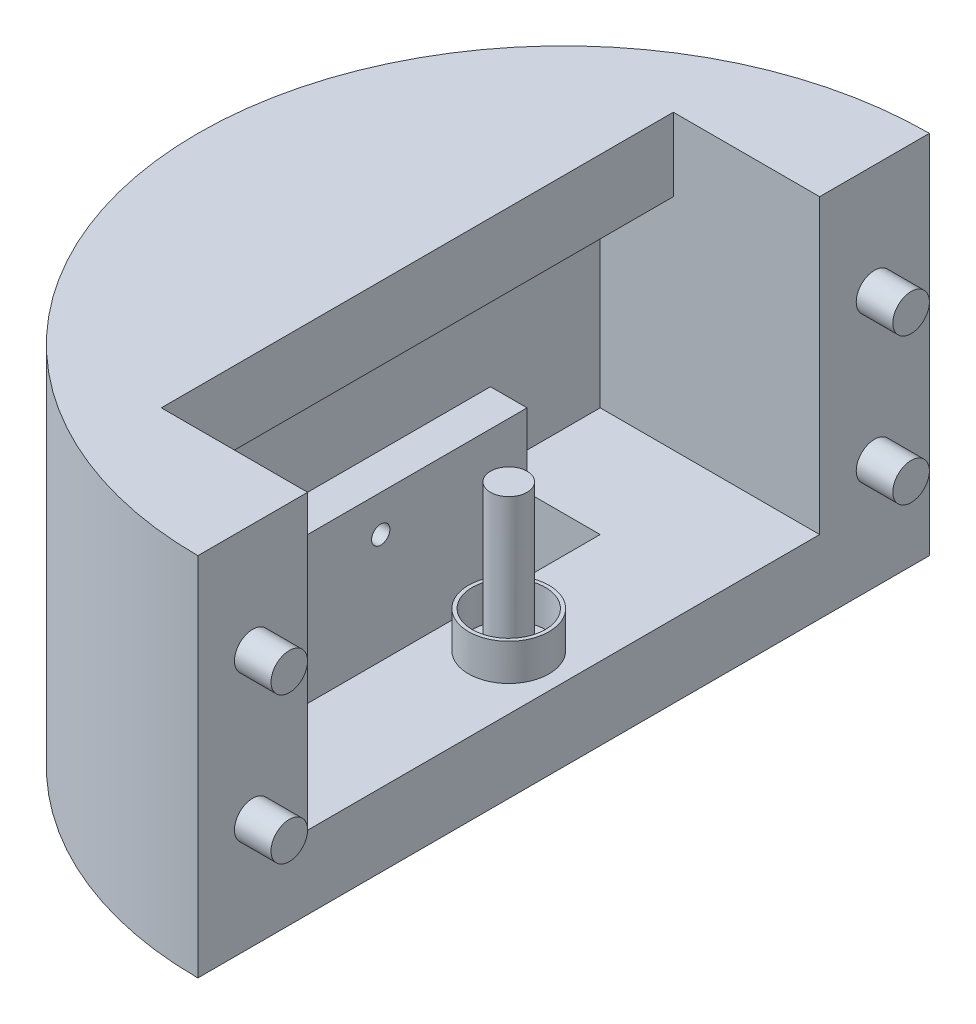
from build123d import *

# Parameters (mm, degrees)
SZKIC1_W                     = 5
SZKIC1_H                     = 10
DODANIE_WYCI_GNI_CIE1_DEPTH  = 1
DODANIE_WYCI_GNI_CIE4_DEPTH  = 4
ZAOKR_GLENIE2_R              = 5
SZKIC3_W                     = 1
SZKIC3_H                     = 4
WYTNIJ_WYCI_GNI_CIE1_DEPTH   = 4
SZKIC4_W                     = 0.5
SZKIC4_H                     = 4
DODANIE_WYCI_GNI_CIE5_DEPTH  = 1
SZKIC5_R                     = 0.25
DODANIE_WYCI_GNI_CIE6_DEPTH  = 2
SZKIC6_R                     = 0.55
SZKIC6_R_2                   = 0.5
DODANIE_WYCI_GNI_CIE7_DEPTH  = 0.5
SZKIC7_W                     = 7
SZKIC7_H                     = 1
DODANIE_WYCI_GNI_CIE8_DEPTH  = 1
SZKIC11_R                    = 0.25
DODANIE_WYCI_GNI_CIE10_DEPTH = 0.5
SZKIC12_R                    = 0.125
WYTNIJ_WYCI_GNI_CIE2_DEPTH   = 1


with BuildPart() as part:
    # Szkic1 → Dodanie-wyciągnięcie1 (new body)
    with BuildSketch(Plane(origin=(0, 0, 0), x_dir=(1, 0, 0), z_dir=(0, 1, 0))):
        Rectangle(SZKIC1_W, SZKIC1_H)
    extrude(amount=DODANIE_WYCI_GNI_CIE1_DEPTH)

    # Szkic2 → Dodanie-wyciągnięcie4 (add)
    with BuildSketch(Plane(origin=(0, 1, 0), x_dir=(1, 0, 0), z_dir=(0, 1, 0))):
        Polygon((-2.5, 5), (2.5, 5), (2.5, 3.5), (-0.5, 3.5), (-0.5, -3.5), (2.5, -3.5), (2.5, -5), (-2.5, -5), align=None)
    extrude(amount=DODANIE_WYCI_GNI_CIE4_DEPTH)

    # Zaokrąglenie2
    zaokr_glenie2_edges = [part.edges().sort_by_distance(p)[0] for p in [
        (-2.5, 2.5, -5),
        (-2.5, 2.5, 5),
    ]]
    fillet(zaokr_glenie2_edges, radius=ZAOKR_GLENIE2_R - 0.0001)  # a hair under: the kernel refuses the full size

    # Szkic3 → Wytnij-wyciągnięcie1 (cut)
    with BuildSketch(Plane(origin=(0, 1, 0), x_dir=(1, 0, 0), z_dir=(0, 1, 0))):
        with Locations((0.5, 0)):
            Rectangle(SZKIC3_W, SZKIC3_H)
    extrude(amount=-WYTNIJ_WYCI_GNI_CIE1_DEPTH, mode=Mode.SUBTRACT)

    # Szkic4 → Dodanie-wyciągnięcie5 (add)
    with BuildSketch(Plane(origin=(0, 1, 0), x_dir=(1, 0, 0), z_dir=(0, 1, 0))):
        with Locations((-0.25, 0)):
            Rectangle(SZKIC4_W, SZKIC4_H)
    extrude(amount=DODANIE_WYCI_GNI_CIE5_DEPTH)

    # Szkic5 → Dodanie-wyciągnięcie6 (add)
    with BuildSketch(Plane(origin=(0, 1, 0), x_dir=(1, 0, 0), z_dir=(0, 1, 0))):
        with Locations(Location((1.75, 0, 0), (0, 0, 90))):
            Circle(SZKIC5_R)
    extrude(amount=DODANIE_WYCI_GNI_CIE6_DEPTH)

    # Szkic6 → Dodanie-wyciągnięcie7 (add)
    with BuildSketch(Plane(origin=(0, 1, 0), x_dir=(1, 0, 0), z_dir=(0, 1, 0))):
        with Locations(Location((1.75, 0, 0), (0, 0, 90))):
            Circle(SZKIC6_R)
        with Locations(Location((1.75, 0, 0), (0, 0, 270))):
            Circle(SZKIC6_R_2, mode=Mode.SUBTRACT)
    extrude(amount=DODANIE_WYCI_GNI_CIE7_DEPTH)

    # Szkic7 → Dodanie-wyciągnięcie8 (add)
    with BuildSketch(Plane(origin=(-0.5, 0, 0), x_dir=(0, 0, -1), z_dir=(1, 0, 0))):
        with Locations((0, 4.5)):
            Rectangle(SZKIC7_W, SZKIC7_H)
    extrude(amount=DODANIE_WYCI_GNI_CIE8_DEPTH)

    # Szkic11 → Dodanie-wyciągnięcie10 (add)
    with BuildSketch(Plane(origin=(2.5, 0, 0), x_dir=(0, 0, -1), z_dir=(1, 0, 0))):
        with Locations(Location((-4.25, 3.503110499, 0), (0, 0, 180))):
            Circle(SZKIC11_R)
        with Locations(Location((-4.25, 1.503110499, 0), (0, 0, 180))):
            Circle(SZKIC11_R)
        with Locations(Location((4.25, 3.503110499, 0), (0, 0, 180))):
            Circle(SZKIC11_R)
        with Locations(Location((4.25, 1.503110499, 0), (0, 0, 180))):
            Circle(SZKIC11_R)
    extrude(amount=DODANIE_WYCI_GNI_CIE10_DEPTH)

    # Szkic12 → Wytnij-wyciągnięcie2 (cut)
    with BuildSketch(Plane(origin=(0, 0, 0), x_dir=(0, 0, -1), z_dir=(1, 0, 0))):
        with Locations((0, 1.5)):
            Circle(SZKIC12_R)
    extrude(amount=-WYTNIJ_WYCI_GNI_CIE2_DEPTH, mode=Mode.SUBTRACT)


solid = part.part
